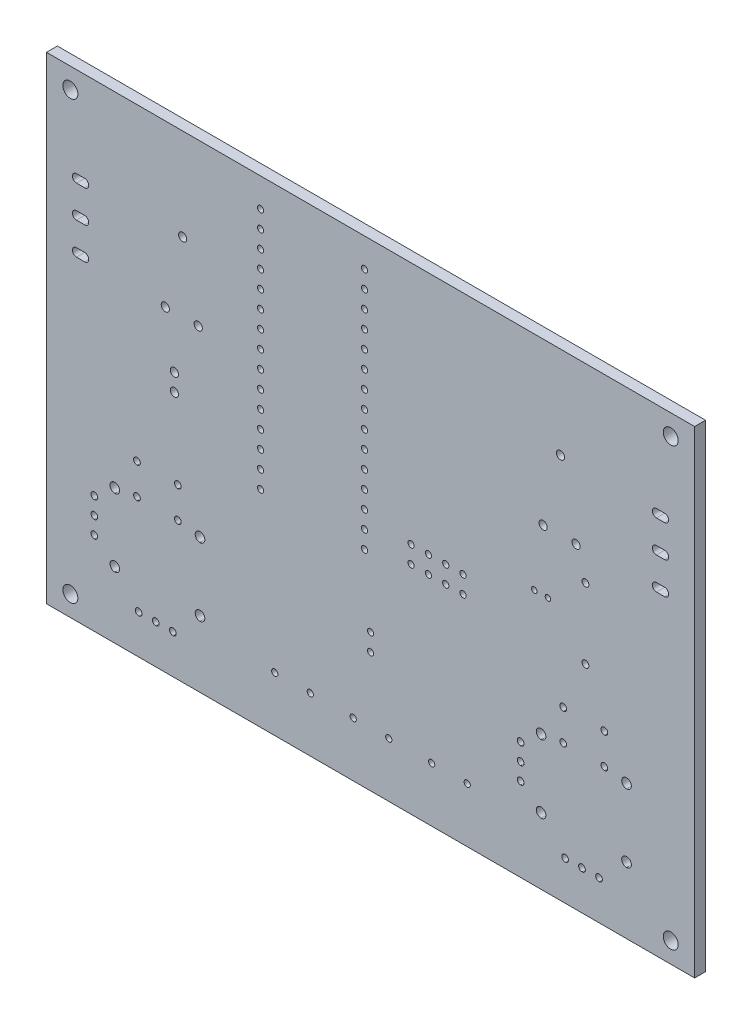
from build123d import *

# Parameters (mm, degrees)
SKETCH1_W           = 95.0000132
SKETCH1_H           = 70.0000124
SKETCH1_R           = 1.0999978
SKETCH1_R_2         = 0.4572
SKETCH1_R_3         = 0.4500118
SKETCH1_R_4         = 0.499999
SKETCH1_R_5         = 0.5999988
SKETCH1_R_6         = 0.3999992
BOSS_EXTRUDE1_DEPTH = 0.8
CUT_EXTRUDE1_DEPTH  = 119.015101762


with BuildPart() as part:
    # Sketch1 → Boss-Extrude1 (new, symmetric)
    with BuildSketch(Plane.XY):
        with Locations((47.5000066, 35.0000062)):
            Rectangle(SKETCH1_W, SKETCH1_H)
        with Locations((3.50012, 2.9999686)):
            Circle(SKETCH1_R, mode=Mode.SUBTRACT)
        with Locations((91.499944, 2.9999686)):
            Circle(SKETCH1_R, mode=Mode.SUBTRACT)
        with Locations((3.50012, 66.9998406)):
            Circle(SKETCH1_R, mode=Mode.SUBTRACT)
        with Locations((91.499944, 66.9998406)):
            Circle(SKETCH1_R, mode=Mode.SUBTRACT)
        with Locations((33.4600042, 8.0000094)):
            Circle(SKETCH1_R_2, mode=Mode.SUBTRACT)
        with Locations((38.6670042, 8.0000094)):
            Circle(SKETCH1_R_2, mode=Mode.SUBTRACT)
        with Locations((44.9599558, 8.0000094)):
            Circle(SKETCH1_R_2, mode=Mode.SUBTRACT)
        with Locations((47.4980254, 17.602962)):
            Circle(SKETCH1_R_3, mode=Mode.SUBTRACT)
        with Locations((47.4980254, 20.142962)):
            Circle(SKETCH1_R_3, mode=Mode.SUBTRACT)
        with Locations((31.3800236, 30.2200056)):
            Circle(SKETCH1_R_2, mode=Mode.SUBTRACT)
        with Locations((31.3800236, 32.7600056)):
            Circle(SKETCH1_R_2, mode=Mode.SUBTRACT)
        with Locations((46.6200236, 30.2200056)):
            Circle(SKETCH1_R_2, mode=Mode.SUBTRACT)
        with Locations((46.6200236, 32.7600056)):
            Circle(SKETCH1_R_2, mode=Mode.SUBTRACT)
        with Locations((50.1669558, 8.0000094)):
            Circle(SKETCH1_R_2, mode=Mode.SUBTRACT)
        with Locations((56.460009, 8.0000094)):
            Circle(SKETCH1_R_2, mode=Mode.SUBTRACT)
        with Locations((61.667009, 8.0000094)):
            Circle(SKETCH1_R_2, mode=Mode.SUBTRACT)
        with Locations((53.4399998, 31.7300102)):
            Circle(SKETCH1_R_2, mode=Mode.SUBTRACT)
        with Locations((55.9799998, 31.7300102)):
            Circle(SKETCH1_R_2, mode=Mode.SUBTRACT)
        with Locations((58.5199998, 31.7300102)):
            Circle(SKETCH1_R_2, mode=Mode.SUBTRACT)
        with Locations((53.4399998, 34.2700102)):
            Circle(SKETCH1_R_2, mode=Mode.SUBTRACT)
        with Locations((55.9799998, 34.2700102)):
            Circle(SKETCH1_R_2, mode=Mode.SUBTRACT)
        with Locations((58.5199998, 34.2700102)):
            Circle(SKETCH1_R_2, mode=Mode.SUBTRACT)
        with Locations((61.0599998, 31.7300102)):
            Circle(SKETCH1_R_2, mode=Mode.SUBTRACT)
        with Locations((61.0599998, 34.2700102)):
            Circle(SKETCH1_R_2, mode=Mode.SUBTRACT)
        with Locations((79.00035, 31.8504062)):
            Circle(SKETCH1_R_4, mode=Mode.SUBTRACT)
        with Locations((18.7500006, 36.2300012)):
            Circle(SKETCH1_R_5, mode=Mode.SUBTRACT)
        with Locations((18.7500006, 38.7700012)):
            Circle(SKETCH1_R_5, mode=Mode.SUBTRACT)
        with BuildLine():
            Line((4.4000166, 47.4000068), (5.6000142, 47.4000068))
            ThreePointArc((5.6000142, 47.4000068), (6.200013, 46.800008), (5.6000142, 46.2000092))
            Line((5.6000142, 46.2000092), (4.4000166, 46.2000092))
            ThreePointArc((4.4000166, 46.2000092), (3.8000178, 46.800008), (4.4000166, 47.4000068))
        make_face(mode=Mode.SUBTRACT)
        with BuildLine():
            Line((4.4000166, 52.0999974), (5.6000142, 52.0999974))
            ThreePointArc((5.6000142, 52.0999974), (6.200013, 51.4999986), (5.6000142, 50.8999998))
            Line((5.6000142, 50.8999998), (4.4000166, 50.8999998))
            ThreePointArc((4.4000166, 50.8999998), (3.8000178, 51.4999986), (4.4000166, 52.0999974))
        make_face(mode=Mode.SUBTRACT)
        with Locations((17.4200058, 46.3799936)):
            Circle(SKETCH1_R_5, mode=Mode.SUBTRACT)
        with Locations((22.2460058, 46.3799936)):
            Circle(SKETCH1_R_5, mode=Mode.SUBTRACT)
        with Locations((31.3800236, 35.3000056)):
            Circle(SKETCH1_R_2, mode=Mode.SUBTRACT)
        with Locations((31.3800236, 37.8400056)):
            Circle(SKETCH1_R_2, mode=Mode.SUBTRACT)
        with Locations((31.3800236, 40.3800056)):
            Circle(SKETCH1_R_2, mode=Mode.SUBTRACT)
        with Locations((31.3800236, 42.9200056)):
            Circle(SKETCH1_R_2, mode=Mode.SUBTRACT)
        with Locations((46.6200236, 35.3000056)):
            Circle(SKETCH1_R_2, mode=Mode.SUBTRACT)
        with Locations((46.6200236, 37.8400056)):
            Circle(SKETCH1_R_2, mode=Mode.SUBTRACT)
        with Locations((46.6200236, 40.3800056)):
            Circle(SKETCH1_R_2, mode=Mode.SUBTRACT)
        with Locations((46.6200236, 42.9200056)):
            Circle(SKETCH1_R_2, mode=Mode.SUBTRACT)
        with Locations((31.3800236, 45.4600056)):
            Circle(SKETCH1_R_2, mode=Mode.SUBTRACT)
        with Locations((31.3800236, 48.0000056)):
            Circle(SKETCH1_R_2, mode=Mode.SUBTRACT)
        with Locations((31.3800236, 50.5400056)):
            Circle(SKETCH1_R_2, mode=Mode.SUBTRACT)
        with Locations((46.6200236, 45.4600056)):
            Circle(SKETCH1_R_2, mode=Mode.SUBTRACT)
        with Locations((46.6200236, 48.0000056)):
            Circle(SKETCH1_R_2, mode=Mode.SUBTRACT)
        with Locations((46.6200236, 50.5400056)):
            Circle(SKETCH1_R_2, mode=Mode.SUBTRACT)
        with BuildLine():
            Line((4.4000166, 56.799988), (5.6000142, 56.799988))
            ThreePointArc((5.6000142, 56.799988), (6.200013, 56.1999892), (5.6000142, 55.5999904))
            Line((5.6000142, 55.5999904), (4.4000166, 55.5999904))
            ThreePointArc((4.4000166, 55.5999904), (3.8000178, 56.1999892), (4.4000166, 56.799988))
        make_face(mode=Mode.SUBTRACT)
        with Locations((19.9600058, 56.5399936)):
            Circle(SKETCH1_R_5, mode=Mode.SUBTRACT)
        with Locations((31.3800236, 53.0800056)):
            Circle(SKETCH1_R_2, mode=Mode.SUBTRACT)
        with Locations((31.3800236, 55.6200056)):
            Circle(SKETCH1_R_2, mode=Mode.SUBTRACT)
        with Locations((31.3800236, 58.1600056)):
            Circle(SKETCH1_R_2, mode=Mode.SUBTRACT)
        with Locations((31.3800236, 60.7000056)):
            Circle(SKETCH1_R_2, mode=Mode.SUBTRACT)
        with Locations((46.6200236, 53.0800056)):
            Circle(SKETCH1_R_2, mode=Mode.SUBTRACT)
        with Locations((46.6200236, 55.6200056)):
            Circle(SKETCH1_R_2, mode=Mode.SUBTRACT)
        with Locations((46.6200236, 58.1600056)):
            Circle(SKETCH1_R_2, mode=Mode.SUBTRACT)
        with Locations((46.6200236, 60.7000056)):
            Circle(SKETCH1_R_2, mode=Mode.SUBTRACT)
        with Locations((31.3800236, 63.2400056)):
            Circle(SKETCH1_R_2, mode=Mode.SUBTRACT)
        with Locations((31.3800236, 65.7800056)):
            Circle(SKETCH1_R_2, mode=Mode.SUBTRACT)
        with Locations((46.6200236, 63.2400056)):
            Circle(SKETCH1_R_2, mode=Mode.SUBTRACT)
        with Locations((46.6200236, 65.7800056)):
            Circle(SKETCH1_R_2, mode=Mode.SUBTRACT)
        with Locations((71.5000094, 37.5000012)):
            Circle(SKETCH1_R_6, mode=Mode.SUBTRACT)
        with Locations((73.5000054, 37.5000012)):
            Circle(SKETCH1_R_6, mode=Mode.SUBTRACT)
        with Locations((79.00035, 42.150411)):
            Circle(SKETCH1_R_4, mode=Mode.SUBTRACT)
        with Locations((72.795003, 46.3799936)):
            Circle(SKETCH1_R_5, mode=Mode.SUBTRACT)
        with Locations((77.621003, 46.3799936)):
            Circle(SKETCH1_R_5, mode=Mode.SUBTRACT)
        with BuildLine():
            Line((89.4000244, 47.4000068), (90.600022, 47.4000068))
            ThreePointArc((90.600022, 47.4000068), (91.2000208, 46.800008), (90.600022, 46.2000092))
            Line((90.600022, 46.2000092), (89.4000244, 46.2000092))
            ThreePointArc((89.4000244, 46.2000092), (88.8000256, 46.800008), (89.4000244, 47.4000068))
        make_face(mode=Mode.SUBTRACT)
        with BuildLine():
            Line((89.4000244, 52.0999974), (90.600022, 52.0999974))
            ThreePointArc((90.600022, 52.0999974), (91.2000208, 51.4999986), (90.600022, 50.8999998))
            Line((90.600022, 50.8999998), (89.4000244, 50.8999998))
            ThreePointArc((89.4000244, 50.8999998), (88.8000256, 51.4999986), (89.4000244, 52.0999974))
        make_face(mode=Mode.SUBTRACT)
        with Locations((75.335003, 56.5399936)):
            Circle(SKETCH1_R_5, mode=Mode.SUBTRACT)
        with BuildLine():
            Line((89.4000244, 56.799988), (90.600022, 56.799988))
            ThreePointArc((90.600022, 56.799988), (91.2000208, 56.1999892), (90.600022, 55.5999904))
            Line((90.600022, 55.5999904), (89.4000244, 55.5999904))
            ThreePointArc((89.4000244, 55.5999904), (88.8000256, 56.1999892), (89.4000244, 56.799988))
        make_face(mode=Mode.SUBTRACT)
    extrude(amount=BOSS_EXTRUDE1_DEPTH, both=True)

    # Sketch4 → Cut-Extrude1 (cut, through all)
    with BuildSketch(Plane.XY.offset(0.8)):
        with BuildLine():
            add(Edge.make_bspline(
                [(10.018886736, 19.014720069), (10.40855395, 19.014720069), (10.724442291, 19.330603027), (10.724442291, 20.109948222), (10.40855395, 20.42583118), (9.629214138, 20.42583118), (9.31333118, 20.109948222), (9.31333118, 19.330603027), (9.629214138, 19.014720069), (10.018886736, 19.014720069)],
                knots=[0, 0, 0, 0, 1, 1, 2, 2, 3.000013814, 3.000013814, 4.000027629, 4.000027629, 4.000027629, 4.000027629], degree=3))
        make_face()
        with BuildLine():
            add(Edge.make_bspline(
                [(22.507223299, 19.014720069), (22.896890513, 19.014720069), (23.212778854, 19.330603027), (23.212778854, 20.109948222), (22.896890513, 20.42583118), (22.117556085, 20.42583118), (21.801667743, 20.109948222), (21.801667743, 19.330603027), (22.117556085, 19.014720069), (22.507223299, 19.014720069)],
                knots=[0, 0, 0, 0, 1, 1, 2, 2, 3, 3, 4, 4, 4, 4], degree=3))
        make_face()
        with BuildLine():
            add(Edge.make_bspline(
                [(22.507223299, 9.031102498), (22.896890513, 9.031102498), (23.212778854, 9.346985457), (23.212778854, 10.126330651), (22.896890513, 10.442213609), (22.117556085, 10.442213609), (21.801667743, 10.126330651), (21.801667743, 9.346985457), (22.117556085, 9.031102498), (22.507223299, 9.031102498)],
                knots=[0, 0, 0, 0, 1, 1, 2, 2, 3, 3, 4, 4, 4, 4], degree=3))
        make_face()
        with BuildLine():
            add(Edge.make_bspline(
                [(10.018886736, 9.031102498), (10.40855395, 9.031102498), (10.724442291, 9.346985457), (10.724442291, 10.126330651), (10.40855395, 10.442213609), (9.629214138, 10.442213609), (9.31333118, 10.126330651), (9.31333118, 9.346985457), (9.629214138, 9.031102498), (10.018886736, 9.031102498)],
                knots=[0, 0, 0, 0, 1, 1, 2, 2, 3.000013814, 3.000013814, 4.000027629, 4.000027629, 4.000027629, 4.000027629], degree=3))
        make_face()
        with BuildLine():
            add(Edge.make_bspline(
                [(18.520833333, 5.221106805), (18.793598768, 5.221106805), (19.014720069, 5.442228105), (19.014720069, 5.987758976), (18.793598768, 6.208880276), (18.248067898, 6.208880276), (18.026946598, 5.987758976), (18.026946598, 5.442228105), (18.248067898, 5.221106805), (18.520833333, 5.221106805)],
                knots=[0, 0, 0, 0, 1, 1, 2, 2, 3, 3, 4, 4, 4, 4], degree=3))
        make_face()
        with BuildLine():
            add(Edge.make_bspline(
                [(16.016108958, 5.221106805), (16.288874393, 5.221106805), (16.509995694, 5.442228105), (16.509995694, 5.987758976), (16.288874393, 6.208880276), (15.743343523, 6.208880276), (15.522222222, 5.987758976), (15.522222222, 5.442228105), (15.743343523, 5.221106805), (16.016108958, 5.221106805)],
                knots=[0, 0, 0, 0, 1, 1, 2, 2, 3, 3, 4, 4, 4, 4], degree=3))
        make_face()
        with BuildLine():
            add(Edge.make_bspline(
                [(13.511389965, 5.221106805), (13.784155401, 5.221106805), (14.005276701, 5.442228105), (14.005276701, 5.987758976), (13.784155401, 6.208880276), (13.23862453, 6.208880276), (13.01750323, 5.987758976), (13.01750323, 5.442228105), (13.23862453, 5.221106805), (13.511389965, 5.221106805)],
                knots=[0, 0, 0, 0, 1, 1, 2, 2, 3, 3, 4, 4, 4, 4], degree=3))
        make_face()
        with BuildLine():
            add(Edge.make_bspline(
                [(7.020275625, 14.216940138), (7.29304106, 14.216940138), (7.51416236, 14.438061439), (7.51416236, 14.983592309), (7.29304106, 15.204713609), (6.747510189, 15.204713609), (6.526388889, 14.983592309), (6.526388889, 14.438061439), (6.747510189, 14.216940138), (7.020275625, 14.216940138)],
                knots=[0, 0, 0, 0, 1, 1, 2, 2, 3, 3, 4, 4, 4, 4], degree=3))
        make_face()
        with BuildLine():
            add(Edge.make_bspline(
                [(7.020275625, 11.747495694), (7.29304106, 11.747495694), (7.51416236, 11.968616994), (7.51416236, 12.514147864), (7.29304106, 12.735269165), (6.747510189, 12.735269165), (6.526388889, 12.514147864), (6.526388889, 11.968616994), (6.747510189, 11.747495694), (7.020275625, 11.747495694)],
                knots=[0, 0, 0, 0, 1, 1, 2, 2, 3, 3, 4, 4, 4, 4], degree=3))
        make_face()
        with BuildLine():
            add(Edge.make_bspline(
                [(7.020275625, 16.721664513), (7.29304106, 16.721664513), (7.51416236, 16.942785814), (7.51416236, 17.488316684), (7.29304106, 17.709437985), (6.747510189, 17.709437985), (6.526388889, 17.488316684), (6.526388889, 16.942785814), (6.747510189, 16.721664513), (7.020275625, 16.721664513)],
                knots=[0, 0, 0, 0, 1, 1, 2, 2, 3, 3, 4, 4, 4, 4], degree=3))
        make_face()
        with BuildLine():
            add(Edge.make_bspline(
                [(19.26166882, 19.720275625), (19.534434255, 19.720275625), (19.755555556, 19.941396925), (19.755555556, 20.486927795), (19.534434255, 20.708049096), (18.988903385, 20.708049096), (18.767782084, 20.486927795), (18.767782084, 19.941396925), (18.988903385, 19.720275625), (19.26166882, 19.720275625)],
                knots=[0, 0, 0, 0, 1, 1, 2, 2, 3, 3, 4, 4, 4, 4], degree=3))
        make_face()
        with BuildLine():
            add(Edge.make_bspline(
                [(13.264446598, 19.720275625), (13.537212033, 19.720275625), (13.758333333, 19.941396925), (13.758333333, 20.486927795), (13.537212033, 20.708049096), (12.991681163, 20.708049096), (12.770559862, 20.486927795), (12.770559862, 19.941396925), (12.991681163, 19.720275625), (13.264446598, 19.720275625)],
                knots=[0, 0, 0, 0, 1, 1, 2, 2, 3, 3, 4, 4, 4, 4], degree=3))
        make_face()
        with BuildLine():
            add(Edge.make_bspline(
                [(13.264446598, 24.235826874), (13.537212033, 24.235826874), (13.758333333, 24.456948174), (13.758333333, 25.002479045), (13.537212033, 25.223600345), (12.991681163, 25.223600345), (12.770559862, 25.002479045), (12.770559862, 24.456948174), (12.991681163, 24.235826874), (13.264446598, 24.235826874)],
                knots=[0, 0, 0, 0, 1, 1, 2, 2, 3, 3, 4, 4, 4, 4], degree=3))
        make_face()
        with BuildLine():
            add(Edge.make_bspline(
                [(19.26166882, 24.235826874), (19.534434255, 24.235826874), (19.755555556, 24.456948174), (19.755555556, 25.002479045), (19.534434255, 25.223600345), (18.988903385, 25.223600345), (18.767782084, 25.002479045), (18.767782084, 24.456948174), (18.988903385, 24.235826874), (19.26166882, 24.235826874)],
                knots=[0, 0, 0, 0, 1, 1, 2, 2, 3, 3, 4, 4, 4, 4], degree=3))
        make_face()
        with BuildLine():
            add(Edge.make_bspline(
                [(72.495833333, 19.014720069), (72.885500548, 19.014720069), (73.201388889, 19.330603027), (73.201388889, 20.109948222), (72.885500548, 20.42583118), (72.106166119, 20.42583118), (71.790277778, 20.109948222), (71.790277778, 19.330603027), (72.106166119, 19.014720069), (72.495833333, 19.014720069)],
                knots=[0, 0, 0, 0, 1, 1, 2, 2, 3, 3, 4, 4, 4, 4], degree=3))
        make_face()
        with BuildLine():
            add(Edge.make_bspline(
                [(85.019444444, 19.014720069), (85.409111659, 19.014720069), (85.725, 19.330603027), (85.725, 20.109948222), (85.409111659, 20.42583118), (84.62977723, 20.42583118), (84.313888889, 20.109948222), (84.313888889, 19.330603027), (84.62977723, 19.014720069), (85.019444444, 19.014720069)],
                knots=[0, 0, 0, 0, 1, 1, 2, 2, 3, 3, 4, 4, 4, 4], degree=3))
        make_face()
        with BuildLine():
            add(Edge.make_bspline(
                [(85.019444444, 9.031102498), (85.409111659, 9.031102498), (85.725, 9.346985457), (85.725, 10.126330651), (85.409111659, 10.442213609), (84.62977723, 10.442213609), (84.313888889, 10.126330651), (84.313888889, 9.346985457), (84.62977723, 9.031102498), (85.019444444, 9.031102498)],
                knots=[0, 0, 0, 0, 1, 1, 2, 2, 3, 3, 4, 4, 4, 4], degree=3))
        make_face()
        with BuildLine():
            add(Edge.make_bspline(
                [(72.495833333, 9.031102498), (72.885500548, 9.031102498), (73.201388889, 9.346985457), (73.201388889, 10.126330651), (72.885500548, 10.442213609), (72.106166119, 10.442213609), (71.790277778, 10.126330651), (71.790277778, 9.346985457), (72.106166119, 9.031102498), (72.495833333, 9.031102498)],
                knots=[0, 0, 0, 0, 1, 1, 2, 2, 3, 3, 4, 4, 4, 4], degree=3))
        make_face()
        with BuildLine():
            add(Edge.make_bspline(
                [(80.997777239, 5.221106805), (81.27054402, 5.221106805), (81.491666667, 5.442228105), (81.491666667, 5.987758976), (81.27054402, 6.208880276), (80.725010459, 6.208880276), (80.503887812, 5.987758976), (80.503887812, 5.442228105), (80.725010459, 5.221106805), (80.997777239, 5.221106805)],
                knots=[0, 0, 0, 0, 1, 1, 2, 2, 3, 3, 4, 4, 4, 4], degree=3))
        make_face()
        with BuildLine():
            add(Edge.make_bspline(
                [(78.493055556, 5.221106805), (78.765822336, 5.221106805), (78.986944983, 5.442228105), (78.986944983, 5.987758976), (78.765822336, 6.208880276), (78.220288775, 6.208880276), (77.999166128, 5.987758976), (77.999166128, 5.442228105), (78.220288775, 5.221106805), (78.493055556, 5.221106805)],
                knots=[0, 0, 0, 0, 1, 1, 2, 2, 3, 3, 4, 4, 4, 4], degree=3))
        make_face()
        with BuildLine():
            add(Edge.make_bspline(
                [(76.023611111, 5.221106805), (76.296379238, 5.221106805), (76.517500538, 5.442228105), (76.517500538, 5.987758976), (76.296379238, 6.208880276), (75.750842985, 6.208880276), (75.529721684, 5.987758976), (75.529721684, 5.442228105), (75.750842985, 5.221106805), (76.023611111, 5.221106805)],
                knots=[0, 0, 0, 0, 1, 1, 2, 2, 3, 3, 4, 4, 4, 4], degree=3))
        make_face()
        with BuildLine():
            add(Edge.make_bspline(
                [(69.497222222, 14.216940138), (69.769990349, 14.216940138), (69.991111649, 14.438061439), (69.991111649, 14.983592309), (69.769990349, 15.204713609), (69.224454096, 15.204713609), (69.003332795, 14.983592309), (69.003332795, 14.438061439), (69.224454096, 14.216940138), (69.497222222, 14.216940138)],
                knots=[0, 0, 0, 0, 1, 1, 2, 2, 3, 3, 4, 4, 4, 4], degree=3))
        make_face()
        with BuildLine():
            add(Edge.make_bspline(
                [(69.497222222, 11.747495694), (69.769990349, 11.747495694), (69.991111649, 11.968616994), (69.991111649, 12.514147864), (69.769990349, 12.735269165), (69.224454096, 12.735269165), (69.003332795, 12.514147864), (69.003332795, 11.968616994), (69.224454096, 11.747495694), (69.497222222, 11.747495694)],
                knots=[0, 0, 0, 0, 1, 1, 2, 2, 3, 3, 4, 4, 4, 4], degree=3))
        make_face()
        with BuildLine():
            add(Edge.make_bspline(
                [(69.497222222, 16.721664513), (69.769990349, 16.721664513), (69.991111649, 16.942785814), (69.991111649, 17.488316684), (69.769990349, 17.709437985), (69.224454096, 17.709437985), (69.003332795, 17.488316684), (69.003332795, 16.942785814), (69.224454096, 16.721664513), (69.497222222, 16.721664513)],
                knots=[0, 0, 0, 0, 1, 1, 2, 2, 3, 3, 4, 4, 4, 4], degree=3))
        make_face()
        with BuildLine():
            add(Edge.make_bspline(
                [(81.77388862, 19.720275625), (82.046655401, 19.720275625), (82.267778047, 19.941396925), (82.267778047, 20.486927795), (82.046655401, 20.708049096), (81.501121839, 20.708049096), (81.279999193, 20.486927795), (81.279999193, 19.941396925), (81.501121839, 19.720275625), (81.77388862, 19.720275625)],
                knots=[0, 0, 0, 0, 1, 1, 2, 2, 3, 3, 4, 4, 4, 4], degree=3))
        make_face()
        with BuildLine():
            add(Edge.make_bspline(
                [(75.741387812, 19.720275625), (76.014155939, 19.720275625), (76.235277239, 19.941396925), (76.235277239, 20.486927795), (76.014155939, 20.708049096), (75.468619686, 20.708049096), (75.247498385, 20.486927795), (75.247498385, 19.941396925), (75.468619686, 19.720275625), (75.741387812, 19.720275625)],
                knots=[0, 0, 0, 0, 1, 1, 2, 2, 3, 3, 4, 4, 4, 4], degree=3))
        make_face()
        with BuildLine():
            add(Edge.make_bspline(
                [(75.741387812, 24.235826874), (76.014155939, 24.235826874), (76.235277239, 24.456948174), (76.235277239, 25.002479045), (76.014155939, 25.223600345), (75.468619686, 25.223600345), (75.247498385, 25.002479045), (75.247498385, 24.456948174), (75.468619686, 24.235826874), (75.741387812, 24.235826874)],
                knots=[0, 0, 0, 0, 1, 1, 2, 2, 3, 3, 4, 4, 4, 4], degree=3))
        make_face()
        with BuildLine():
            add(Edge.make_bspline(
                [(81.77388862, 24.235826874), (82.046655401, 24.235826874), (82.267778047, 24.456948174), (82.267778047, 25.002479045), (82.046655401, 25.223600345), (81.501121839, 25.223600345), (81.279999193, 25.002479045), (81.279999193, 24.456948174), (81.501121839, 24.235826874), (81.77388862, 24.235826874)],
                knots=[0, 0, 0, 0, 1, 1, 2, 2, 3, 3, 4, 4, 4, 4], degree=3))
        make_face()
    extrude(amount=-CUT_EXTRUDE1_DEPTH, mode=Mode.SUBTRACT)


solid = part.part
